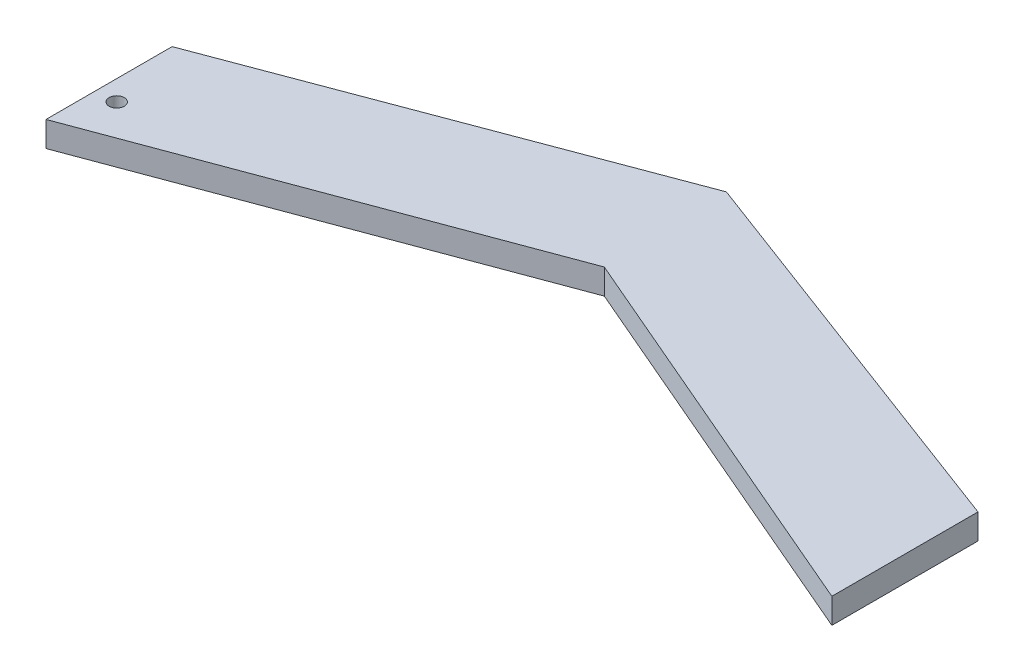
from build123d import *

# Parameters (mm, degrees)
BOSS_EXTRUDE1_DEPTH = 6.35
SKETCH3_R           = 1.905
CUT_EXTRUDE1_DEPTH  = 215.664048705


with BuildPart() as part:
    # Sketch1 → Boss-Extrude1 (new body)
    with BuildSketch(Plane(origin=(0, 0, 0), x_dir=(1, 0, 0), z_dir=(0, 1, 0))):
        Polygon((0, 0), (102.450856344, 38.1), (202.8825, -5.042472322), (202.8825, 31.75), (101.44125, 69.85), (0, 31.75), align=None)
    extrude(amount=BOSS_EXTRUDE1_DEPTH)

    # Sketch3 → Cut-Extrude1 (cut, through all)
    with BuildSketch(Plane(origin=(0, 6.35, 0), x_dir=(1, 0, 0), z_dir=(0, 1, 0))):
        with Locations((5.084373941, 12.717527547)):
            Circle(SKETCH3_R)
    extrude(amount=-CUT_EXTRUDE1_DEPTH, mode=Mode.SUBTRACT)


solid = part.part
